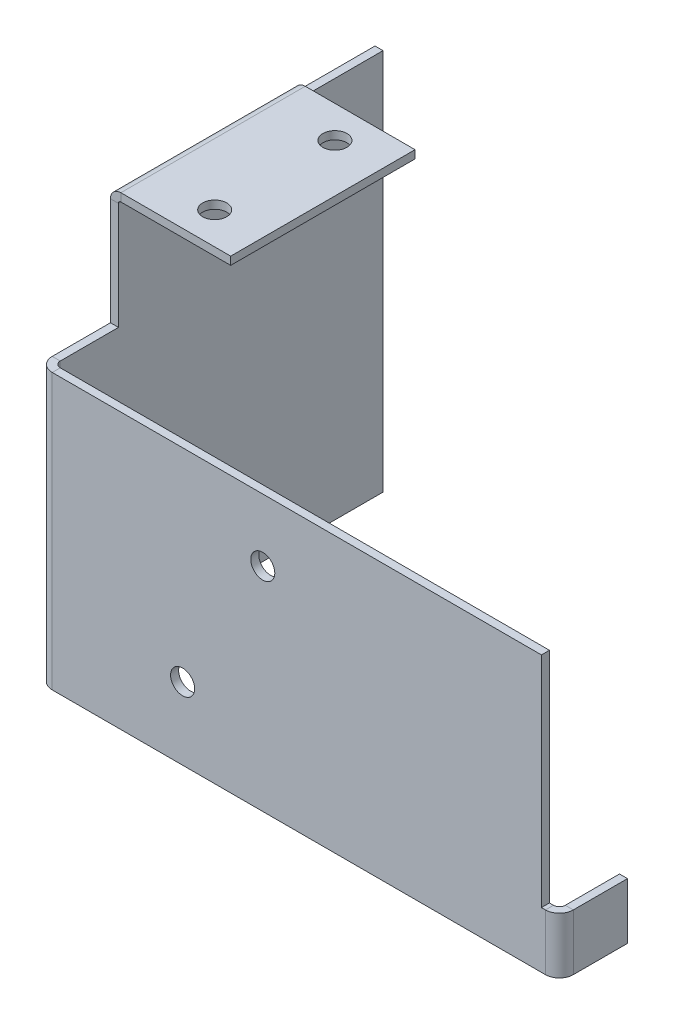
from build123d import *

# Parameters (mm, degrees)
SKETCH1_W                     = 15
SKETCH1_H                     = 23
BASE_FLANGE1_DEPTH            = 1
EDGE_FLANGE1_STRIP_W          = 4.6
EDGE_FLANGE1_STRIP_H          = 1
EDGE_FLANGE1_STRIP_CUT_DEPTH  = 23
EDGE_FLANGE1_DEPTH            = 23
SKETCH10_W                    = 10
SKETCH10_H                    = 47.7
BOSS_EXTRUDE2_DEPTH           = 1
SKETCH15_W                    = 1
SKETCH15_H                    = 34.3
BOSS_EXTRUDE3_DEPTH           = 9
EDGE_FLANGE3_STRIP_W          = 5.4732
EDGE_FLANGE3_STRIP_H          = 1
EDGE_FLANGE3_STRIP_CUT_DEPTH  = 34.3
EDGE_FLANGE3_DEPTH            = 34.3
EDGE_FLANGE4_STRIP_W          = 5.4732
EDGE_FLANGE4_STRIP_H          = 1
EDGE_FLANGE4_STRIP_CUT_DEPTH  = 7
EDGE_FLANGE4_RELIEF_W         = 5.9732
EDGE_FLANGE4_RELIEF_H         = 1000
EDGE_FLANGE4_RELIEF_CUT_DEPTH = 1
EDGE_FLANGE4_DEPTH            = 7
SKETCH31_R                    = 1.5
CUT_EXTRUDE1_DEPTH            = 82.639451248
SKETCH32_R                    = 1.5
CUT_EXTRUDE2_DEPTH            = 10


# Sheet-metal steps are written as plain solids
with BuildPart() as part:
    # Sketch1 → Base-Flange1 (new body)
    with BuildSketch(Plane(origin=(0, 0, 0), x_dir=(1, 0, 0), z_dir=(0, 1, 0))):
        with Locations((-7.5, -11.5)):
            Rectangle(SKETCH1_W, SKETCH1_H)
    extrude(amount=-BASE_FLANGE1_DEPTH)

    # Edge-Flange1 strip (across the edge) → Edge-Flange1 strip cut (cut)
    with BuildSketch(Plane(origin=(-15, -1, 23), x_dir=(1, 0, 0), z_dir=(0, 0, -1))):
        with Locations((-1, -0.5)):
            Rectangle(EDGE_FLANGE1_STRIP_W, EDGE_FLANGE1_STRIP_H)
    extrude(amount=EDGE_FLANGE1_STRIP_CUT_DEPTH, mode=Mode.SUBTRACT)

    # Edge-Flange1 section (across the edge) → Edge-Flange1 (add)
    with BuildSketch(Plane(origin=(-15, -1, 23), x_dir=(1, 0, 0), z_dir=(0, 0, -1))):
        with BuildLine():
            Line((0, 0.3), (0, 48))
            Line((0, 48), (1, 48))
            Line((1, 48), (1, 0.3))
            ThreePointArc((1, 0.3), (1.087867966, 0.087867966), (1.3, 0))
            Line((1.3, 0), (1.3, -1))
            ThreePointArc((1.3, -1), (0.380761184, -0.619238816), (0, 0.3))
        make_face()
    extrude(amount=EDGE_FLANGE1_DEPTH)

    # Sketch10 → Boss-Extrude2 (add)
    with BuildSketch(Plane.ZY.offset(15)):
        with Locations((-5, -25.15)):
            Rectangle(SKETCH10_W, SKETCH10_H)
    extrude(amount=-BOSS_EXTRUDE2_DEPTH)

    # Sketch15 → Boss-Extrude3 (add)
    with BuildSketch(Plane.XY.offset(23)):
        with Locations((-14.5, -31.85)):
            Rectangle(SKETCH15_W, SKETCH15_H)
    extrude(amount=BOSS_EXTRUDE3_DEPTH)

    # Edge-Flange3 strip (across the edge) → Edge-Flange3 strip cut (cut)
    with BuildSketch(Plane(origin=(-14, -14.7, 32), x_dir=(0, 0, -1), z_dir=(0, -1, 0))):
        with Locations((-1, -0.5)):
            Rectangle(EDGE_FLANGE3_STRIP_W, EDGE_FLANGE3_STRIP_H)
    extrude(amount=EDGE_FLANGE3_STRIP_CUT_DEPTH, mode=Mode.SUBTRACT)

    # Edge-Flange3 section (across the edge) → Edge-Flange3 (add)
    with BuildSketch(Plane(origin=(-14, -14.7, 32), x_dir=(0, 0, -1), z_dir=(0, -1, 0))):
        with BuildLine():
            Line((0, 0.7366), (0, 64))
            Line((0, 64), (1, 64))
            Line((1, 64), (1, 0.7366))
            ThreePointArc((1, 0.7366), (1.215745145, 0.215745145), (1.7366, 0))
            Line((1.7366, 0), (1.7366, -1))
            ThreePointArc((1.7366, -1), (0.508638364, -0.491361636), (0, 0.7366))
        make_face()
    extrude(amount=EDGE_FLANGE3_DEPTH)

    # Edge-Flange4 strip (across the edge) → Edge-Flange4 strip cut (cut)
    with BuildSketch(Plane(origin=(50, -42, 31), x_dir=(-1, 0, 0), z_dir=(0, -1, 0))):
        with Locations((-1, -0.5)):
            Rectangle(EDGE_FLANGE4_STRIP_W, EDGE_FLANGE4_STRIP_H)
    extrude(amount=EDGE_FLANGE4_STRIP_CUT_DEPTH, mode=Mode.SUBTRACT)

    # Edge-Flange4 relief (on the sheet) → Edge-Flange4 relief cut (cut)
    with BuildSketch(Plane(origin=(48.2634, -42, 31), x_dir=(-1, 0, 0), z_dir=(0, 0, -1))):
        with Locations((-2.4866, 500)):
            Rectangle(EDGE_FLANGE4_RELIEF_W, EDGE_FLANGE4_RELIEF_H)
    extrude(amount=-EDGE_FLANGE4_RELIEF_CUT_DEPTH, mode=Mode.SUBTRACT)

    # Edge-Flange4 section (across the edge) → Edge-Flange4 (add)
    with BuildSketch(Plane(origin=(50, -42, 31), x_dir=(-1, 0, 0), z_dir=(0, -1, 0))):
        with BuildLine():
            Line((0, 0.7366), (0, 7.5))
            Line((0, 7.5), (1, 7.5))
            Line((1, 7.5), (1, 0.7366))
            ThreePointArc((1, 0.7366), (1.215745145, 0.215745145), (1.7366, 0))
            Line((1.7366, 0), (1.7366, -1))
            ThreePointArc((1.7366, -1), (0.508638364, -0.491361636), (0, 0.7366))
        make_face()
    extrude(amount=EDGE_FLANGE4_DEPTH)

    # Sketch31 → Cut-Extrude1 (cut, through all)
    with BuildSketch(Plane.XY.offset(32)):
        with Locations((3, -40)):
            Circle(SKETCH31_R)
        with Locations((13, -22.5)):
            Circle(SKETCH31_R)
    extrude(amount=-CUT_EXTRUDE1_DEPTH, mode=Mode.SUBTRACT)

    # Sketch32 → Cut-Extrude2 (cut)
    with BuildSketch(Plane(origin=(0, 0, 0), x_dir=(1, 0, 0), z_dir=(0, 1, 0))):
        with Locations(Location((-6, -4, 0), (0, 0, 270))):
            Circle(SKETCH32_R)
        with Locations(Location((-6, -19, 0), (0, 0, 270))):
            Circle(SKETCH32_R)
    extrude(amount=-CUT_EXTRUDE2_DEPTH, mode=Mode.SUBTRACT)


solid = part.part
